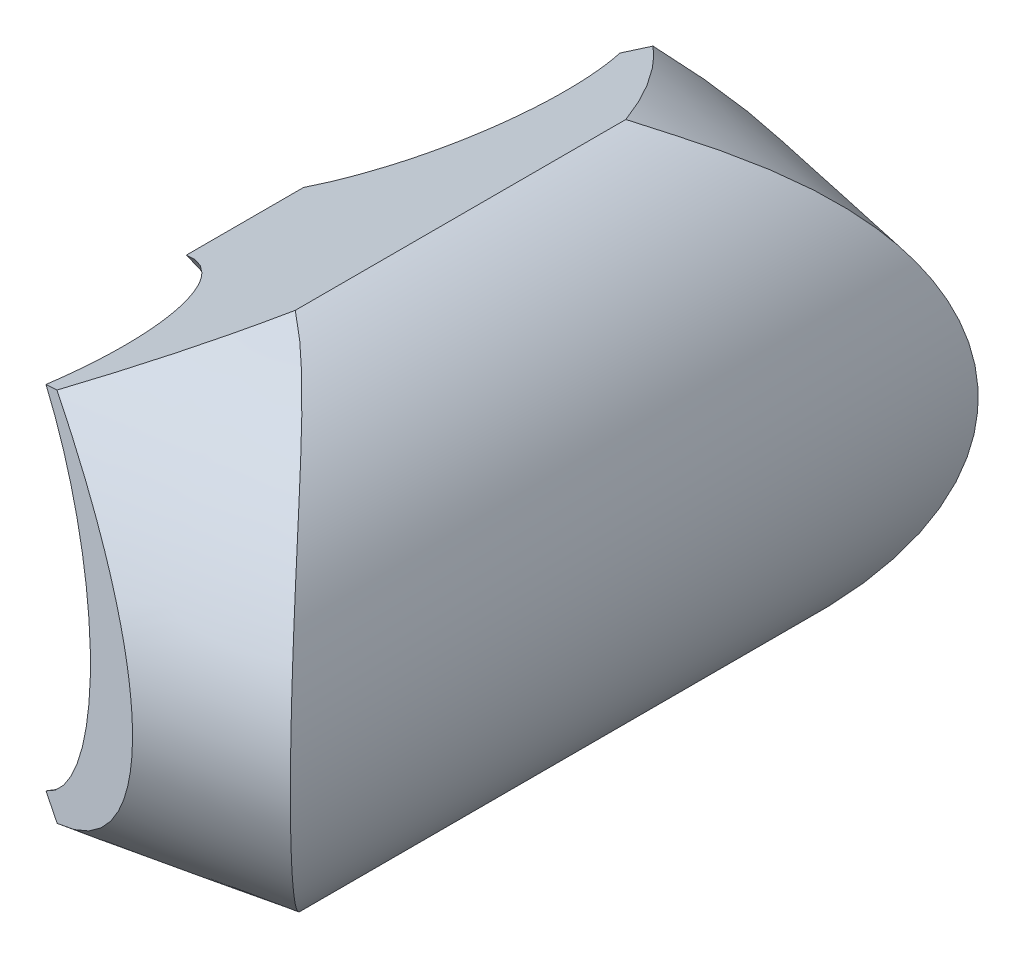
from build123d import *

# Parameters (mm, degrees)
CUT_EXTRUDE4_DEPTH      = 253.624676717
CUT_EXTRUDE4_DEPTH_BACK = 253.624676717
CUT_EXTRUDE5_DEPTH      = 245.483894262
CUT_EXTRUDE5_DEPTH_BACK = 245.483894262
CUT_EXTRUDE6_DEPTH      = 236.095154216
CUT_EXTRUDE6_DEPTH_BACK = 236.095154216


with BuildPart() as part:
    # Loft1: read off the stored shape, not the designer's step
    # Loft1: loft between two sections, ruled curve by curve
    loft1_from = [
        Edge.make_bspline([(0, -103.729865383, 62.397342989), (0, -186.926322702, -248.79225316), (0, 20.533408064, -373.586939139), (0, 103.729865383, -62.397342989), (0, 186.926322702, 248.79225316), (0, -20.533408064, 373.586939139), (0, -103.729865383, 62.397342989)], [0, 0, 0, 0, 0.5, 0.5, 0.5, 1, 1, 1, 1], 3, [1, 0.333333333, 0.333333333, 1, 0.333333333, 0.333333333, 1]),
    ]
    loft1_to = [
        Edge.make_bspline([(152.4, -94.310819612, 45.926612739), (152.4, -162.767468789, -207.160650016), (152.4, 25.854170434, -299.013875495), (152.4, 94.310819612, -45.926612739), (152.4, 162.767468789, 207.160650016), (152.4, -25.854170434, 299.013875495), (152.4, -94.310819612, 45.926612739)], [0, 0, 0, 0, 0.5, 0.5, 0.5, 1, 1, 1, 1], 3, [1, 0.333333333, 0.333333333, 1, 0.333333333, 0.333333333, 1]),
    ]
    loft1 = Solid(Shell([*[Face.make_surface_from_curves(loft1_from[k], loft1_to[k]) for k in range(1)], Face(Wire(loft1_from)), Face(Wire(loft1_to))]))
    add(loft1)

    # Sketch3 → Cut-Revolve2 (revolve, cut)
    with BuildSketch(Plane.ZY):
        with BuildLine():
            Line((86.36, 81.28), (86.36, -81.28))
            ThreePointArc((86.36, -81.28), (5.08, 0), (86.36, 81.28))
        make_face()
    cut_revolve2 = revolve(axis=Axis((0, 81.28, 86.36), (0, -1, 0)), mode=Mode.SUBTRACT)

    # Sketch7 → Cut-Extrude4 (cut, two sides: drawn at the far end of the back side and taken through both)
    with BuildSketch(Plane.XY.offset(-CUT_EXTRUDE4_DEPTH_BACK)):
        Polygon((0, 50.8), (0, -50.8), (101.6, -104.126780833), (101.6, -129.526780833), (-10, -129.526780833), (-10, 129.526780834), (101.6, 129.526780834), (101.6, 104.126780834), align=None)
    extrude(amount=CUT_EXTRUDE4_DEPTH + CUT_EXTRUDE4_DEPTH_BACK, mode=Mode.SUBTRACT)

    # Mirror5: Cut-Revolve2 across plane
    add(cut_revolve2.mirror(Plane.XY), mode=Mode.SUBTRACT)

    # Sketch9 → Cut-Extrude5 (cut, two sides: drawn at the far end of the back side and taken through both)
    with BuildSketch(Plane(origin=(0, 0, 0), x_dir=(1, 0, 0), z_dir=(0, 1, 0)).offset(-CUT_EXTRUDE5_DEPTH_BACK)):
        Polygon((0, 95.25), (0, -95.25), (101.6, -145.607640487), (101.6, -171.007640487), (-10, -171.007640487), (-10, 171.007640487), (101.6, 171.007640487), (101.6, 145.607640487), align=None)
    extrude(amount=CUT_EXTRUDE5_DEPTH + CUT_EXTRUDE5_DEPTH_BACK, mode=Mode.SUBTRACT)

    # Sketch11 → Cut-Extrude6 (cut, two sides: drawn at the far end of the back side and taken through both)
    with BuildSketch(Plane.XY.offset(-CUT_EXTRUDE6_DEPTH_BACK)):
        with BuildLine():
            Line((52.07, 100.33), (52.07, 115.33))
            Line((52.07, 115.33), (162.4, 115.33))
            Line((162.4, 115.33), (162.4, -115.33))
            Line((162.4, -115.33), (52.07, -115.33))
            Line((52.07, -115.33), (52.07, -100.33))
            ThreePointArc((52.07, -100.33), (152.4, 0), (52.07, 100.33))
        make_face()
    extrude(amount=CUT_EXTRUDE6_DEPTH + CUT_EXTRUDE6_DEPTH_BACK, mode=Mode.SUBTRACT)


solid = part.part
